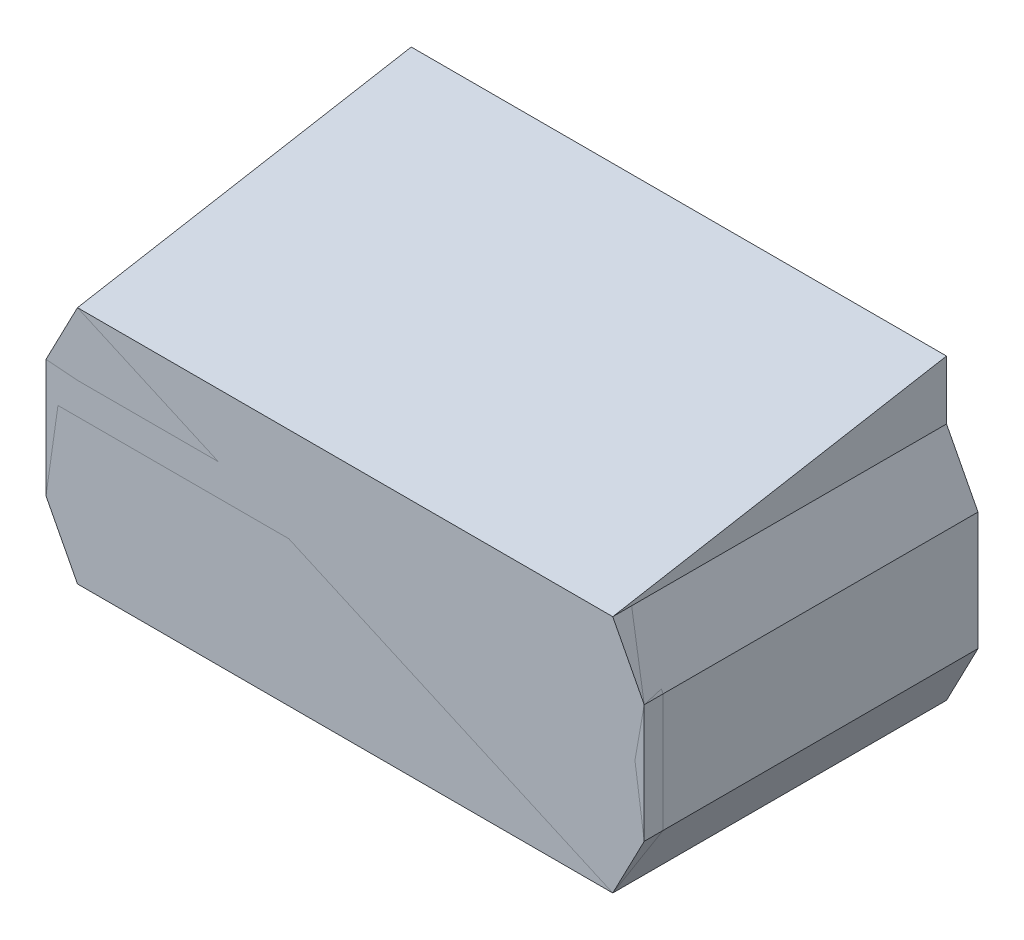
from build123d import *

# Parameters (mm, degrees)
SKETCH1_W                      = 85
SKETCH1_H                      = 93
BOSS_EXTRUDE1_BASE_DEPTH       = 3
BOSS_EXTRUDE4_SIDE_WALLS_DEPTH = 93
CUT_EXTRUDE2_START             = 3
CUT_EXTRUDE2_GUIDE_HOLES_DEPTH = 138.881429411
SKETCH15_W                     = 85
SKETCH15_H                     = 20
BOSS_EXTRUDE9_REAR_WALL_DEPTH  = 3
BOSS_EXTRUDE1_START            = 3
SKETCH17_W                     = 85
SKETCH17_H                     = 3
BOSS_EXTRUDE1_REAR_WALL_DEPTH  = 12
SKETCH30_W                     = 85
SKETCH30_H                     = 2
CUT_EXTRUDE1_REAR_WALL_DEPTH   = 10
BOSS_EXTRUDE2_START            = 25
SKETCH20_W                     = 3
SKETCH20_H                     = 90
BOSS_EXTRUDE2_SIDE_WALL_DEPTH  = 10
CHAMFER1_SIDE_WALL_SIZE        = 3
BOSS_EXTRUDE5_SIDE_WALL_DEPTH  = 30
CHAMFER2_ROOF_SIZE             = 30
CHAMFER2_ROOF_SIZE_2           = 170.138454589
SKETCH28_W                     = 85
SKETCH28_H                     = 94.434674906
BOSS_EXTRUDE7_ROOF_DEPTH       = 3
SKETCH29_W                     = 5.082998623
SKETCH29_H                     = 55.59785115
CUT_EXTRUDE1_CLEAN_UP_DEPTH    = 144.980394466
SKETCH31_W                     = 95
SKETCH31_H                     = 40
CUT_EXTRUDE2_CLEAN_UP_DEPTH    = 141.385850156
BOSS_EXTRUDE1_DEPTH            = 3


# Some blends are built 0.0001 mm under size
with BuildPart() as part:
    # Sketch1 → Boss-Extrude1 _Base (new body)
    with BuildSketch(Plane(origin=(0, 0, 0), x_dir=(1, 0, 0), z_dir=(0, 1, 0))):
        with Locations((42.5, 46.5)):
            Rectangle(SKETCH1_W, SKETCH1_H)
    extrude(amount=BOSS_EXTRUDE1_BASE_DEPTH)

    # Sketch5 → Boss-Extrude4 _Side Walls (add, through all)
    with BuildSketch(Plane.XY):
        Polygon((-5, 28.390936655), (0, 38), (0, 0), (-5, 9.609063345), align=None)
        Polygon((90, 9.609063345), (90, 28.390936655), (85, 38), (85, 0), align=None)
    extrude(amount=-BOSS_EXTRUDE4_SIDE_WALLS_DEPTH)

    # Sketch4 → Cut-Extrude2 _Guide Holes (cut, through all)
    with BuildSketch(Plane.XY.offset(CUT_EXTRUDE2_START)):
        Polygon((-3.1, 23), (0, 26.1), (0, 23), align=None)
        Polygon((85, 23), (88.1, 23), (85, 26.1), align=None)
    extrude(amount=-CUT_EXTRUDE2_GUIDE_HOLES_DEPTH, mode=Mode.SUBTRACT)

    # Sketch15 → Boss-Extrude9 _Rear Wall (add)
    with BuildSketch(Plane.XY):
        with Locations((42.5, 13)):
            Rectangle(SKETCH15_W, SKETCH15_H)
    extrude(amount=-BOSS_EXTRUDE9_REAR_WALL_DEPTH)

    # Sketch17 → Boss-Extrude1 _Rear Wall (add)
    with BuildSketch(Plane(origin=(0, 23, 0), x_dir=(1, 0, 0), z_dir=(0, 1, 0)).offset(BOSS_EXTRUDE1_START)):
        with Locations((42.5, 1.5)):
            Rectangle(SKETCH17_W, SKETCH17_H)
    extrude(amount=BOSS_EXTRUDE1_REAR_WALL_DEPTH)

    # Sketch30 → Cut-Extrude1 _Rear Wall (cut)
    with BuildSketch(Plane.XY):
        with Locations((42.5, 27)):
            Rectangle(SKETCH30_W, SKETCH30_H)
    extrude(amount=-CUT_EXTRUDE1_REAR_WALL_DEPTH, mode=Mode.SUBTRACT)

    # Sketch20 → Boss-Extrude2 _Side Wall (add)
    with BuildSketch(Plane(origin=(0, 3, 0), x_dir=(1, 0, 0), z_dir=(0, 1, 0)).offset(BOSS_EXTRUDE2_START)):
        with Locations((1.5, 48)):
            Rectangle(SKETCH20_W, SKETCH20_H)
        with Locations((83.5, 48)):
            Rectangle(SKETCH20_W, SKETCH20_H)
    extrude(amount=BOSS_EXTRUDE2_SIDE_WALL_DEPTH)

    # Chamfer1 _Side Wall
    chamfer1_side_wall_edges = [part.edges().sort_by_distance(p)[0] for p in [
        (82, 28, -48),
        (3, 28, -48),
    ]]
    chamfer(chamfer1_side_wall_edges, length=CHAMFER1_SIDE_WALL_SIZE - 0.0001)  # a hair under: the kernel refuses the full size

    # Sketch26 → Boss-Extrude5 _Side Wall (add)
    with BuildSketch(Plane(origin=(0, 38, 0), x_dir=(1, 0, 0), z_dir=(0, 1, 0))):
        Polygon((0, 0), (0, 93), (3, 93), (3, 3), (82, 3), (82, 93), (85, 93), (85, 0), align=None)
    extrude(amount=BOSS_EXTRUDE5_SIDE_WALL_DEPTH)

    # Chamfer2 _Roof
    # the kernel refuses this chamfer: 170.138454589, 30 mm, written as the material it takes off along each edge
    with BuildSketch(Plane(origin=(527.111375011, 68, 0), x_dir=(0, -0.9776715712462578, 0.21013876076743532), z_dir=(-1, 0, 0))) as chamfer2_roof_piece_1:
        Polygon((CHAMFER2_ROOF_SIZE * 0.977671571246, -CHAMFER2_ROOF_SIZE * 0.210138760767), (-CHAMFER2_ROOF_SIZE_2 * 0.210138760767, -CHAMFER2_ROOF_SIZE_2 * 0.977671571244), (0, 0), align=None)
    extrude(amount=969.222750023, mode=Mode.SUBTRACT)

    # Sketch28 → Boss-Extrude7 _Roof (add)
    with BuildSketch(Plane(origin=(0, 36.854159795, 6.498382723), x_dir=(1, 0, 0), z_dir=(0, 0.9848077530122086, 0.17364817766692742))):
        with Locations((42.5, 53.815968204)):
            Rectangle(SKETCH28_W, SKETCH28_H)
    extrude(amount=-BOSS_EXTRUDE7_ROOF_DEPTH)

    # Sketch29 → Cut-Extrude1 _Clean up (cut, through all)
    with BuildSketch(Plane(origin=(90, 0, 0), x_dir=(0, 0, -1), z_dir=(1, 0, 0))):
        with Locations((95.541499312, 27.798925575)):
            Rectangle(SKETCH29_W, SKETCH29_H)
    extrude(amount=-CUT_EXTRUDE1_CLEAN_UP_DEPTH, mode=Mode.SUBTRACT)

    # Sketch31 → Cut-Extrude2 _Clean Up (cut, through all)
    with BuildSketch(Plane.XZ):
        with Locations((42.5, -73)):
            Rectangle(SKETCH31_W, SKETCH31_H)
    extrude(amount=-CUT_EXTRUDE2_CLEAN_UP_DEPTH, mode=Mode.SUBTRACT)


with BuildPart() as body_2:
    # Sketch33 → Boss-Extrude1 (new body)
    with BuildSketch(Plane.XY):
        Polygon((-5, 28.390936655), (0, 38), (85, 38), (90, 28.390936655), (90, 9.609063345), (85, 0), (0, 0), (-5, 9.609063345), align=None)
    extrude(amount=-BOSS_EXTRUDE1_DEPTH)


solid = Compound([part.part, body_2.part])
